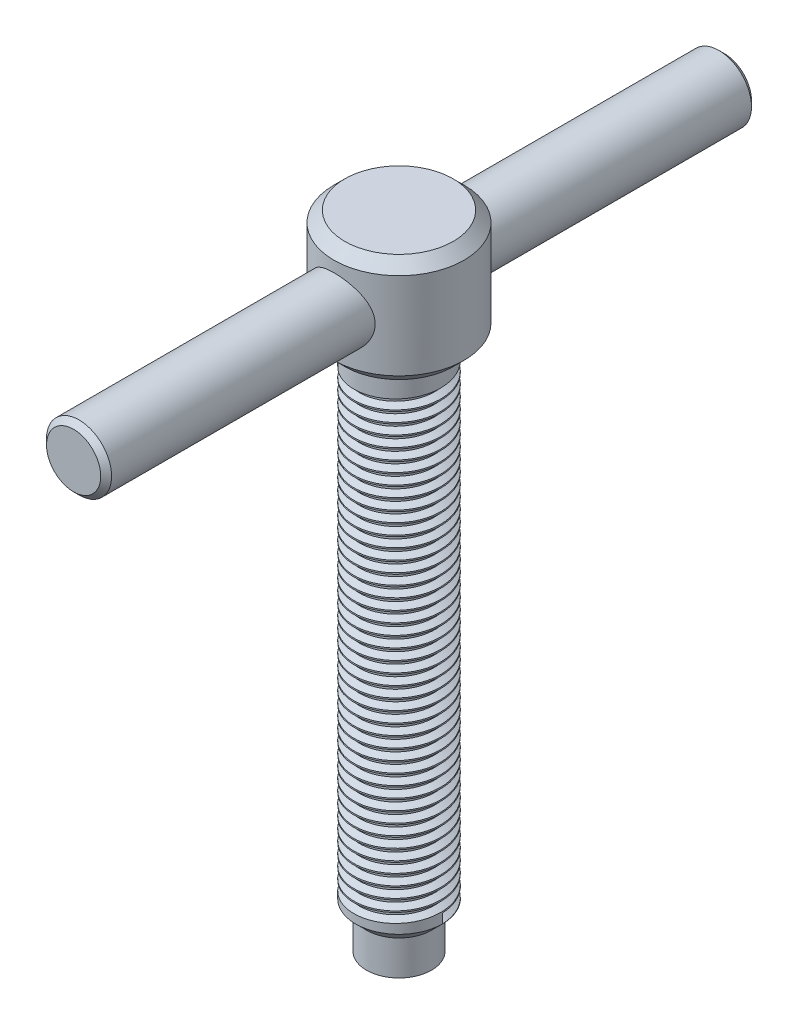
from build123d import *

# Parameters (mm, degrees)
SKETCH_2_R      = 6
EXTRUDE_1_DEPTH = 60
CHAMFER_1_SIZE  = 1
CHAMFER_3_SIZE  = 2
THREAD_1_PITCH  = 2


with BuildPart() as part:
    # Sketch 1 → 旋转1 (revolve)
    with BuildSketch(Plane.XY, mode=Mode.PRIVATE) as revolve_1_sk:
        with BuildLine():
            Line((12, 0), (12, -20))
            Line((12, -20), (8, -20))
            Line((8, -20), (8, -112))
            Line((8, -112), (6, -112))
            Line((6, -112), (6, -118.392304845))
            ThreePointArc((6, -118.392304845), (3.105828541, -119.591109915), (0, -120))
            Line((0, -120), (0, 0))
            Line((0, 0), (12, 0))
        make_face()
    revolve(revolve_1_sk.sketch.rotate(Axis((0, 0, 0), (0, -1, 0)), 180), axis=Axis((0, 0, 0), (0, -1, 0)))

    # 草图2 → 凸台-拉伸1 (add, symmetric)
    with BuildSketch(Plane.XY):
        with Locations(Location((0, -10, 0), (0, 0, 180))):
            Circle(SKETCH_2_R)
    extrude(amount=EXTRUDE_1_DEPTH, both=True)

    # 倒角1
    chamfer_1_edges = [part.edges().sort_by_distance(p)[0] for p in [
        (6, -10, -60),
        (6, -10, 60),
    ]]
    chamfer(chamfer_1_edges, length=CHAMFER_1_SIZE)

    # 倒角3
    chamfer_3_edges = [part.edges().sort_by_distance(p)[0] for p in [
        (8, -112, 0),
        (12, -20, 0),
        (12, 0, 0),
    ]]
    chamfer(chamfer_3_edges, length=CHAMFER_3_SIZE - 0.0001)  # a hair under: the kernel refuses the full size

    # 螺纹线1: the profile of Sketch 1 2 profile screwed along a right-hand helix of 42.5 turns, 10 arcs to a turn; built about Z, then put on its axis
    thread_1_z = Axis((0, 0, 0), (0, 0, 1))
    thread_1_corners = [(8.0003, 0, -0.000173205), (8.0003, 0, 1.7501732), (6.91746825, 0, 1.124999997), (6.91746825, 0, 0.624999997)]
    with BuildLine(mode=Mode.PRIVATE) as thread_1_profile:
        Line(thread_1_corners[0], thread_1_corners[1])
        Line(thread_1_corners[1], thread_1_corners[2])
        Line(thread_1_corners[2], thread_1_corners[3])
        Line(thread_1_corners[3], thread_1_corners[0])
    thread_1_cap = Face(thread_1_profile.wire())
    thread_1_turn_angles = [0, 18, 36, 54, 72, 90, 108, 126, 144, 162, 180, 198, 216, 234, 252, 270, 288, 306, 324, 342, 360, 378, 396, 414, 432, 450, 468, 486, 504, 522, 540, 558, 576, 594, 612, 630, 648, 666, 684, 702, 720]
    thread_1_turn_weights = [1, 0.9510565162951535, 1, 0.9510565162951535, 1, 0.9510565162951535, 1, 0.9510565162951535, 1, 0.9510565162951535, 1, 0.9510565162951535, 1, 0.9510565162951535, 1, 0.9510565162951535, 1, 0.9510565162951535, 1, 0.9510565162951535, 1, 0.9510565162951535, 1, 0.9510565162951535, 1, 0.9510565162951535, 1, 0.9510565162951535, 1, 0.9510565162951535, 1, 0.9510565162951535, 1, 0.9510565162951535, 1, 0.9510565162951535, 1, 0.9510565162951535, 1, 0.9510565162951535, 1]
    thread_1_turn_rails = [Edge.make_bspline([Vector(p[0], p[1], 0).rotate(thread_1_z, thread_1_turn_angles[k]) / thread_1_turn_weights[k] + Vector(0, 0, p[2] + THREAD_1_PITCH * thread_1_turn_angles[k] / 360) for k in range(41)], [0, 0, 0, 1, 1, 2, 2, 3, 3, 4, 4, 5, 5, 6, 6, 7, 7, 8, 8, 9, 9, 10, 10, 11, 11, 12, 12, 13, 13, 14, 14, 15, 15, 16, 16, 17, 17, 18, 18, 19, 19, 20, 20, 20], 2, thread_1_turn_weights) for p in thread_1_corners]
    thread_1_turn_sides = [Face.make_surface_from_curves(thread_1_turn_rails[p[0]], thread_1_turn_rails[p[1]]) for p in [(0, 1), (1, 2), (2, 3), (3, 0)]]
    thread_1_last_angles = [15120, 15138, 15156, 15174, 15192, 15210, 15228, 15246, 15264, 15282, 15300]
    thread_1_last_weights = [1, 0.9510565162951535, 1, 0.9510565162951535, 1, 0.9510565162951535, 1, 0.9510565162951535, 1, 0.9510565162951535, 1]
    thread_1_last_rails = [Edge.make_bspline([Vector(p[0], p[1], 0).rotate(thread_1_z, thread_1_last_angles[k]) / thread_1_last_weights[k] + Vector(0, 0, p[2] + THREAD_1_PITCH * thread_1_last_angles[k] / 360) for k in range(11)], [0, 0, 0, 1, 1, 2, 2, 3, 3, 4, 4, 5, 5, 5], 2, thread_1_last_weights) for p in thread_1_corners]
    thread_1_last_sides = [Face.make_surface_from_curves(thread_1_last_rails[p[0]], thread_1_last_rails[p[1]]) for p in [(0, 1), (1, 2), (2, 3), (3, 0)]]
    thread_1 = Plane(origin=(0, -110, 0), x_dir=(1, 0, 0), z_dir=(0, 1, 0)) * Solid(Shell([*[p.moved(Location((0, 0, 2 * THREAD_1_PITCH * i))) for i in range(21) for p in thread_1_turn_sides], *thread_1_last_sides, thread_1_cap, thread_1_cap.rotate(thread_1_z, 15300).moved(Location((0, 0, THREAD_1_PITCH * 15300 / 360)))]))
    add(thread_1, mode=Mode.SUBTRACT)


solid = part.part
